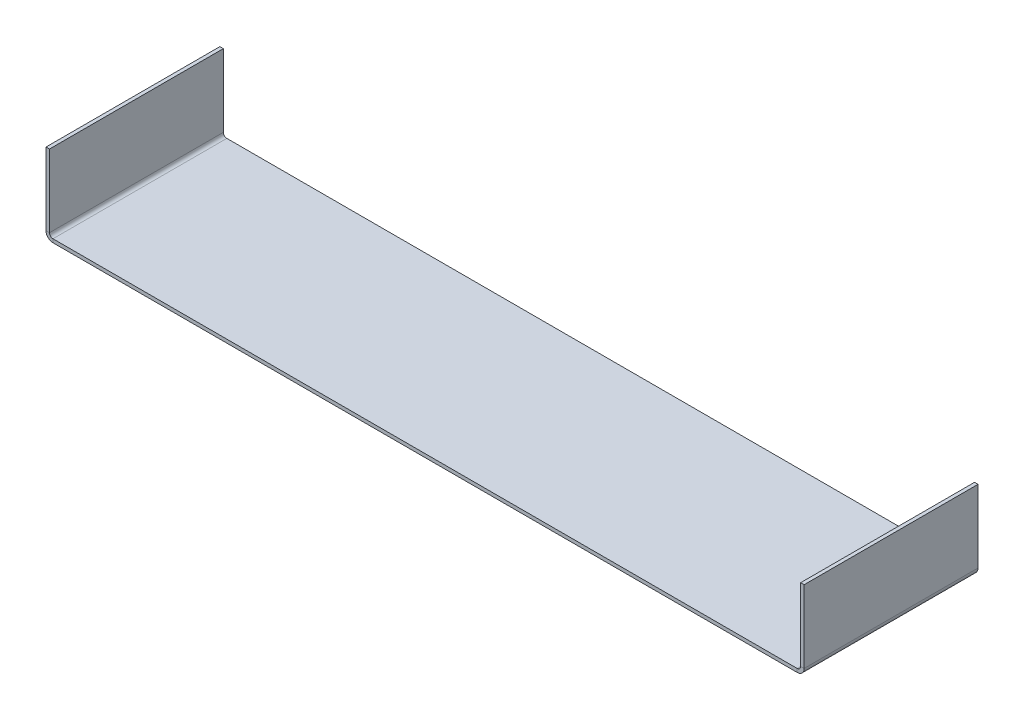
from build123d import *

# Parameters (mm, degrees)
SM_BASE_FLANGE_1_DEPTH = 100


# Sheet-metal steps are written as plain solids
with BuildPart() as part:
    # Sketch 1 → Базовая кромка1 (new body)
    with BuildSketch(Plane.XY):
        with BuildLine():
            Line((0, 0), (0, -41.7))
            ThreePointArc((0, -41.7), (1.171572875, -44.528427125), (4, -45.7))
            Line((4, -45.7), (432, -45.7))
            ThreePointArc((432, -45.7), (434.828427125, -44.528427125), (436, -41.7))
            Line((436, -41.7), (436, 0))
            Line((436, 0), (434, 0))
            Line((434, 0), (434, -41.7))
            ThreePointArc((434, -41.7), (433.414213562, -43.114213562), (432, -43.7))
            Line((432, -43.7), (4, -43.7))
            ThreePointArc((4, -43.7), (2.585786438, -43.114213562), (2, -41.7))
            Line((2, -41.7), (2, 0))
            Line((2, 0), (0, 0))
        make_face()
    extrude(amount=SM_BASE_FLANGE_1_DEPTH)


solid = part.part
